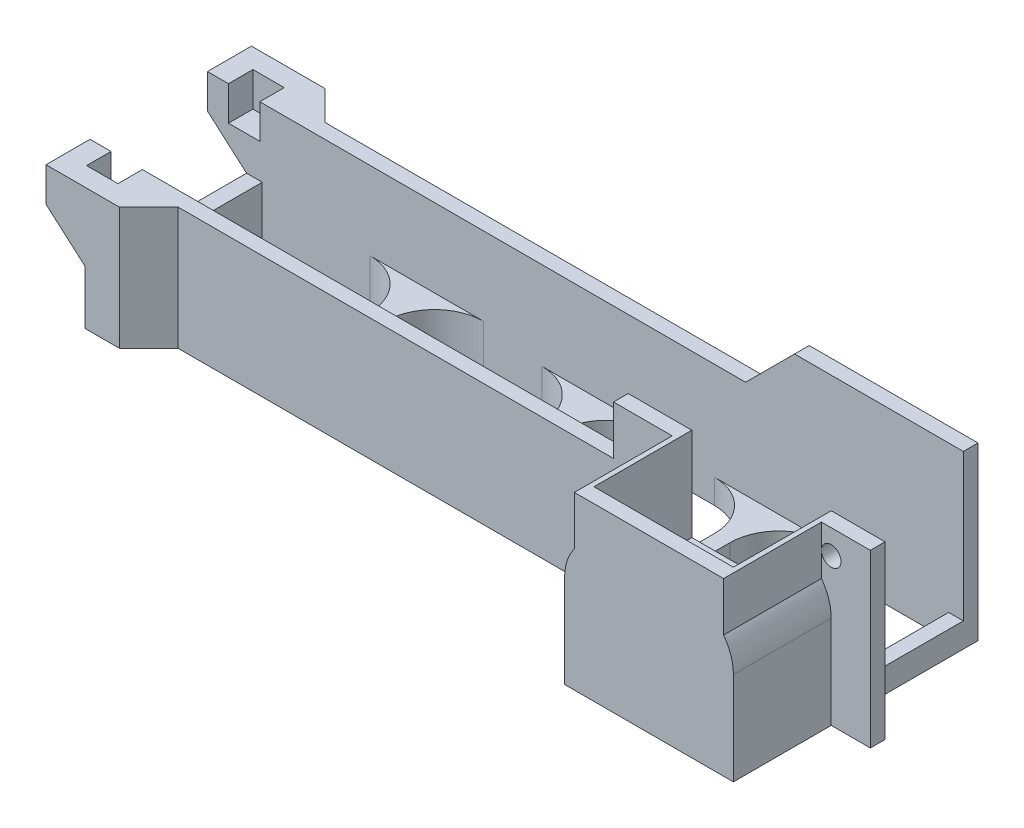
from build123d import *

# Parameters (mm, degrees)
SKETCH1_W               = 154.5
SKETCH1_H               = 30
SKETCH1_W_2             = 34.5
SKETCH1_H_2             = 20
BOSS_EXTRUDE2_DEPTH     = 1
BOSS_EXTRUDE5_DEPTH     = 24
SKETCH5_W               = 3.2
SKETCH5_H               = 10
SKETCH5_H_2             = 8
SKETCH5_H_3             = 6
SKETCH5_H_4             = 4
SKETCH5_W_2             = 3
BOSS_EXTRUDE6_DEPTH     = 24
SKETCH6_W               = 28.5
SKETCH6_H               = 20
BOSS_EXTRUDE7_DEPTH     = 15
BOSS_EXTRUDE8_DEPTH     = 10
SKETCH9_W               = 8
SKETCH9_H               = 3
BOSS_EXTRUDE9_DEPTH     = 25
SKETCH10_R              = 2
CUT_EXTRUDE1_DEPTH      = 8
SKETCH11_W              = 32
SKETCH11_H              = 24
SKETCH11_W_2            = 34.7
CUT_EXTRUDE2_DEPTH      = 8
FILLET1_R               = 10
SKETCH13_W              = 15
SKETCH13_H              = 6
BOSS_EXTRUDE10_DEPTH    = 25
SKETCH15_W              = 6.4
SKETCH15_H              = 5
CUT_EXTRUDE3_DEPTH      = 7
CUT_EXTRUDE4_DEPTH      = 170.470498908
CUT_EXTRUDE4_DEPTH_BACK = 170.470498908
CHAMFER1_SIZE           = 6
SKETCH17_W              = 34.5
SKETCH17_H              = 3
BOSS_EXTRUDE11_DEPTH    = 10
CHAMFER2_SIZE           = 10


# Some blends are built 0.0001 mm under size
with BuildPart() as part:
    # Sketch1 → Boss-Extrude2 (new body)
    with BuildSketch(Plane(origin=(0, 0, 0), x_dir=(1, 0, 0), z_dir=(0, 1, 0))):
        with Locations((77.25, 15)):
            Rectangle(SKETCH1_W, SKETCH1_H)
        with Locations((137.25, -10)):
            Rectangle(SKETCH1_W_2, SKETCH1_H_2)
    extrude(amount=BOSS_EXTRUDE2_DEPTH)

    # Sketch2 → Boss-Extrude5 (add)
    with BuildSketch(Plane(origin=(0, 1, 0), x_dir=(1, 0, 0), z_dir=(0, 1, 0))):
        Polygon((3, 27), (0, 27), (0, 30), (154.5, 30), (154.5, 27), (151.5, 27), align=None)
        Polygon((0, 0), (120, 0), (120, -20), (154.5, -20), (154.5, 3), (151.5, 3), (151.5, -17), (123, -17), (123, 3), (3, 3), (0, 3), align=None)
    extrude(amount=BOSS_EXTRUDE5_DEPTH)

    # Sketch5 → Boss-Extrude6 (add)
    with BuildSketch(Plane.XY.offset(-27)):
        with Locations((9.6, 6)):
            Rectangle(SKETCH5_W, SKETCH5_H)
        with Locations((44.8, 5)):
            Rectangle(SKETCH5_W, SKETCH5_H_2)
        with Locations((80, 4)):
            Rectangle(SKETCH5_W, SKETCH5_H_3)
        with Locations((115.2, 3)):
            Rectangle(SKETCH5_W, SKETCH5_H_4)
        with Locations((153, 3)):
            Rectangle(SKETCH5_W_2, SKETCH5_H_4)
    extrude(amount=BOSS_EXTRUDE6_DEPTH)

    # Sketch6 → Boss-Extrude7 (add)
    with BuildSketch(Plane(origin=(0, 1, 0), x_dir=(1, 0, 0), z_dir=(0, 1, 0))):
        with Locations((137.25, -7)):
            Rectangle(SKETCH6_W, SKETCH6_H)
    extrude(amount=BOSS_EXTRUDE7_DEPTH)

    # Sketch7 → Boss-Extrude8 (add)
    with BuildSketch(Plane(origin=(0, 25, 0), x_dir=(1, 0, 0), z_dir=(0, 1, 0))):
        Polygon((110, 3), (110, 0), (122, 0), (122, -20), (152.5, -20), (152.5, 0), (162.5, 0), (162.5, 3), (151.5, 3), (151.5, -17), (123, -17), (123, 3), align=None)
    extrude(amount=BOSS_EXTRUDE8_DEPTH)

    # Sketch9 → Boss-Extrude9 (add)
    with BuildSketch(Plane.XZ.offset(-25)):
        with Locations((158.5, -1.5)):
            Rectangle(SKETCH9_W, SKETCH9_H)
    extrude(amount=BOSS_EXTRUDE9_DEPTH)

    # Sketch10 → Cut-Extrude1 (cut)
    with BuildSketch(Plane(origin=(0, 0, -3), x_dir=(-1, 0, 0), z_dir=(0, 0, -1))):
        with Locations((-120, 30)):
            Circle(SKETCH10_R)
        with Locations((-154.5, 30)):
            Circle(SKETCH10_R)
    extrude(amount=-CUT_EXTRUDE1_DEPTH, mode=Mode.SUBTRACT)

    # Sketch11 → Cut-Extrude2 (cut)
    with BuildSketch(Plane(origin=(0, 1, 0), x_dir=(1, 0, 0), z_dir=(0, 1, 0))):
        with Locations((27.2, 15)):
            Rectangle(SKETCH11_W, SKETCH11_H)
        with Locations((62.4, 15)):
            Rectangle(SKETCH11_W, SKETCH11_H)
        with Locations((97.6, 15)):
            Rectangle(SKETCH11_W, SKETCH11_H)
        with Locations((134.15, 15)):
            Rectangle(SKETCH11_W_2, SKETCH11_H)
    extrude(amount=-CUT_EXTRUDE2_DEPTH, mode=Mode.SUBTRACT)

    # Fillet1
    # the kernel refuses this fillet: 10 mm, written as the material it adds along each edge
    with BuildSketch(Plane(origin=(46.4, 0, -3), x_dir=(1, 0, 0), z_dir=(0, 1, 0)), Plane(origin=(43.2, 9, -3), x_dir=(-1, 0, 0), z_dir=(0, -1, 0)), Plane(origin=(46.4, 9, -27), x_dir=(1, 0, 0), z_dir=(0, -1, 0))) as fillet1_piece_1:
        with BuildLine():
            CenterArc((FILLET1_R, FILLET1_R), FILLET1_R, 180, 90)
            Line((0, FILLET1_R), (0, 0))
            Line((0, 0), (FILLET1_R, 0))
        make_face()
    extrude(amount=9)
    with BuildSketch(Plane(origin=(81.6, 0, -3), x_dir=(1, 0, 0), z_dir=(0, 1, 0)), Plane(origin=(78.4, 0, -27), x_dir=(-1, 0, 0), z_dir=(0, 1, 0)), Plane(origin=(78.4, 7, -3), x_dir=(-1, 0, 0), z_dir=(0, -1, 0)), Plane(origin=(81.6, 7, -27), x_dir=(1, 0, 0), z_dir=(0, -1, 0))) as fillet1_piece_2:
        with BuildLine():
            CenterArc((FILLET1_R, FILLET1_R), FILLET1_R, 180, 90)
            Line((0, FILLET1_R), (0, 0))
            Line((0, 0), (FILLET1_R, 0))
        make_face()
    extrude(amount=7)
    with BuildSketch(Plane(origin=(116.8, 0, -3), x_dir=(1, 0, 0), z_dir=(0, 1, 0)), Plane(origin=(113.6, 0, -27), x_dir=(-1, 0, 0), z_dir=(0, 1, 0)), Plane(origin=(113.6, 5, -3), x_dir=(-1, 0, 0), z_dir=(0, -1, 0))) as fillet1_piece_3:
        with BuildLine():
            CenterArc((FILLET1_R, FILLET1_R), FILLET1_R, 180, 90)
            Line((0, FILLET1_R), (0, 0))
            Line((0, 0), (FILLET1_R, 0))
        make_face()
    extrude(amount=5)
    with BuildSketch(Plane(origin=(43.2, 9, -27), x_dir=(-1, 0, 0), z_dir=(0, -1, 0))) as fillet1_piece_4:
        with BuildLine():
            CenterArc((FILLET1_R, -FILLET1_R), FILLET1_R, 90, 90)
            Line((0, -FILLET1_R), (0, 0))
            Line((0, 0), (FILLET1_R, 0))
        make_face()
    extrude(amount=9)
    with BuildSketch(Plane(origin=(116.8, 5, -27), x_dir=(0, 0, 1), z_dir=(0, -1, 0))) as fillet1_piece_5:
        with BuildLine():
            CenterArc((FILLET1_R, -FILLET1_R), FILLET1_R, 90, 90)
            Line((0, -FILLET1_R), (0, 0))
            Line((0, 0), (FILLET1_R, 0))
        make_face()
    extrude(amount=5)
    # the kernel refuses this fillet: 10 mm, written as the material it takes off along each edge
    with BuildSketch(Plane(origin=(154.5, 25, 35), x_dir=(0, -1, 0), z_dir=(0, 0, -1))) as fillet1_2_piece_1:
        with BuildLine():
            CenterArc((6, 10), FILLET1_R, 233.130102354, 36.869897646)
            Line((0, 2), (0, 0))
            Line((0, 0), (6, 0))
        make_face()
    extrude(amount=35, mode=Mode.SUBTRACT)
    with BuildSketch(Plane(origin=(120, 25, 0), x_dir=(1, 0, 0), z_dir=(0, 0, 1))) as fillet1_2_piece_2:
        with BuildLine():
            CenterArc((10, -6), FILLET1_R, 143.130102354, 36.869897646)
            Line((0, -6), (0, 0))
            Line((0, 0), (2, 0))
        make_face()
    extrude(amount=35, mode=Mode.SUBTRACT)

    # Sketch13 → Boss-Extrude10 (add)
    with BuildSketch(Plane.XZ):
        with Locations((7.5, 3)):
            Rectangle(SKETCH13_W, SKETCH13_H)
    boss_extrude10 = extrude(amount=-BOSS_EXTRUDE10_DEPTH)

    # Sketch15 → Cut-Extrude3 (cut)
    with BuildSketch(Plane(origin=(0, 25, 0), x_dir=(1, 0, 0), z_dir=(0, 1, 0))):
        with Locations((7.5, 0.5)):
            Rectangle(SKETCH15_W, SKETCH15_H)
    cut_extrude3 = extrude(amount=-CUT_EXTRUDE3_DEPTH, mode=Mode.SUBTRACT)

    # Mirror1: Boss-Extrude10, Cut-Extrude3 across plane
    add(boss_extrude10.mirror(Plane.XY.offset(-15)))
    add(cut_extrude3.mirror(Plane.XY.offset(-15)), mode=Mode.SUBTRACT)

    # Sketch16 → Cut-Extrude4 (cut, two sides: drawn at the far end of the back side and taken through both)
    with BuildSketch(Plane(origin=(0, 0, -3), x_dir=(-1, 0, 0), z_dir=(0, 0, -1)).offset(-CUT_EXTRUDE4_DEPTH_BACK)):
        Polygon((-8, 11), (0, 18), (0, 0), (-8, 0), align=None)
    extrude(amount=CUT_EXTRUDE4_DEPTH + CUT_EXTRUDE4_DEPTH_BACK, mode=Mode.SUBTRACT)

    # Chamfer1
    chamfer1_edges = [part.edges().sort_by_distance(p)[0] for p in [
        (15, 12.5, -30),
        (15, 12.5, 0),
    ]]
    chamfer(chamfer1_edges, length=CHAMFER1_SIZE - 0.0001)  # a hair under: the kernel refuses the full size

    # Sketch17 → Boss-Extrude11 (add)
    with BuildSketch(Plane(origin=(0, 25, 0), x_dir=(1, 0, 0), z_dir=(0, 1, 0))):
        with Locations((137.25, 28.5)):
            Rectangle(SKETCH17_W, SKETCH17_H)
    extrude(amount=BOSS_EXTRUDE11_DEPTH)

    # Chamfer2
    chamfer2_edges = [part.edges().sort_by_distance(p)[0] for p in [
        (120, 25, -28.5),
    ]]
    chamfer(chamfer2_edges, length=CHAMFER2_SIZE - 0.0001)  # a hair under: the kernel refuses the full size


solid = part.part
